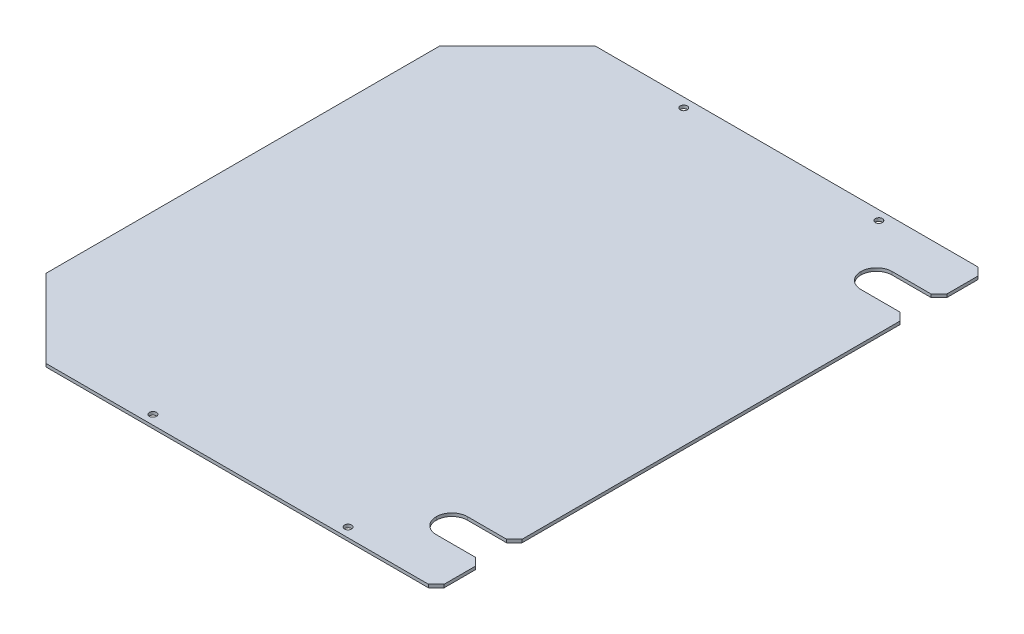
from build123d import *

# Parameters (mm, degrees)
SKETCH1_W          = 300
SKETCH1_H          = 2
BASE_FLANGE1_DEPTH = 352
CHAMFER1_SIZE      = 5
CHAMFER2_SIZE      = 50
CUT_EXTRUDE1_REACH = 384.633
SKETCH2_R          = 2.25
SKETCH3_W          = 40
SKETCH3_H          = 20
CUT_EXTRUDE2_DEPTH = 383.632983419
FILLET1_R          = 10
CHAMFER3_SIZE      = 5


# Sheet-metal steps are written as plain solids
with BuildPart() as part:
    # Sketch1 → Base-Flange1 (new body)
    with BuildSketch(Plane.XY):
        with Locations((0, -1)):
            Rectangle(SKETCH1_W, SKETCH1_H)
    extrude(amount=BASE_FLANGE1_DEPTH)

    # Chamfer1
    chamfer1_edges = [part.edges().sort_by_distance(p)[0] for p in [
        (150, -1, 0),
        (150, -1, 352),
    ]]
    chamfer(chamfer1_edges, length=CHAMFER1_SIZE)

    # Chamfer2
    chamfer2_edges = [part.edges().sort_by_distance(p)[0] for p in [
        (-150, -1, 352),
        (-150, -1, 0),
    ]]
    chamfer(chamfer2_edges, length=CHAMFER2_SIZE)

    # Sketch2 → Cut-Extrude1 (cut, up to next)
    with BuildSketch(Plane.XZ.offset(2), mode=Mode.PRIVATE) as cut_extrude1_sk1:
        with Locations(Location((-37.5, 346, 0), (0, 0, 270))):
            Circle(SKETCH2_R)
    cut_extrude1_tool1 = extrude(cut_extrude1_sk1.sketch, amount=-CUT_EXTRUDE1_REACH, mode=Mode.PRIVATE) & part.part
    # Sketch2 → Cut-Extrude1 (cut, up to next)
    with BuildSketch(Plane.XZ.offset(2), mode=Mode.PRIVATE) as cut_extrude1_sk2:
        with Locations(Location((87.5, 346, 0), (0, 0, 270))):
            Circle(SKETCH2_R)
    cut_extrude1_tool2 = extrude(cut_extrude1_sk2.sketch, amount=-CUT_EXTRUDE1_REACH, mode=Mode.PRIVATE) & part.part
    # Sketch2 → Cut-Extrude1 (cut, up to next)
    with BuildSketch(Plane.XZ.offset(2), mode=Mode.PRIVATE) as cut_extrude1_sk3:
        with Locations(Location((87.5, 6, 0), (0, 0, 270))):
            Circle(SKETCH2_R)
    cut_extrude1_tool3 = extrude(cut_extrude1_sk3.sketch, amount=-CUT_EXTRUDE1_REACH, mode=Mode.PRIVATE) & part.part
    # Sketch2 → Cut-Extrude1 (cut, up to next)
    with BuildSketch(Plane.XZ.offset(2), mode=Mode.PRIVATE) as cut_extrude1_sk4:
        with Locations(Location((-37.5, 6, 0), (0, 0, 270))):
            Circle(SKETCH2_R)
    cut_extrude1_tool4 = extrude(cut_extrude1_sk4.sketch, amount=-CUT_EXTRUDE1_REACH, mode=Mode.PRIVATE) & part.part
    add(cut_extrude1_tool1.solids().sort_by_distance((-37.5, -2, 346))[0], mode=Mode.SUBTRACT)
    add(cut_extrude1_tool2.solids().sort_by_distance((87.5, -2, 346))[0], mode=Mode.SUBTRACT)
    add(cut_extrude1_tool3.solids().sort_by_distance((87.5, -2, 6))[0], mode=Mode.SUBTRACT)
    add(cut_extrude1_tool4.solids().sort_by_distance((-37.5, -2, 6))[0], mode=Mode.SUBTRACT)

    # Sketch3 → Cut-Extrude2 (cut, through all)
    with BuildSketch(Plane(origin=(0, 0, 0), x_dir=(1, 0, 0), z_dir=(0, 1, 0))):
        with Locations((130, -40)):
            Rectangle(SKETCH3_W, SKETCH3_H)
        with Locations((130, -312)):
            Rectangle(SKETCH3_W, SKETCH3_H)
    extrude(amount=-CUT_EXTRUDE2_DEPTH, mode=Mode.SUBTRACT)

    # Fillet1
    fillet1_edges = [part.edges().sort_by_distance(p)[0] for p in [
        (110, -1, 322),
        (110, -1, 302),
        (110, -1, 50),
        (110, -1, 30),
    ]]
    fillet(fillet1_edges, radius=FILLET1_R - 0.0001)  # a hair under: the kernel refuses the full size

    # Chamfer3
    chamfer3_edges = [part.edges().sort_by_distance(p)[0] for p in [
        (150, -1, 30),
        (150, -1, 50),
        (150, -1, 322),
        (150, -1, 302),
    ]]
    chamfer(chamfer3_edges, length=CHAMFER3_SIZE)


solid = part.part
